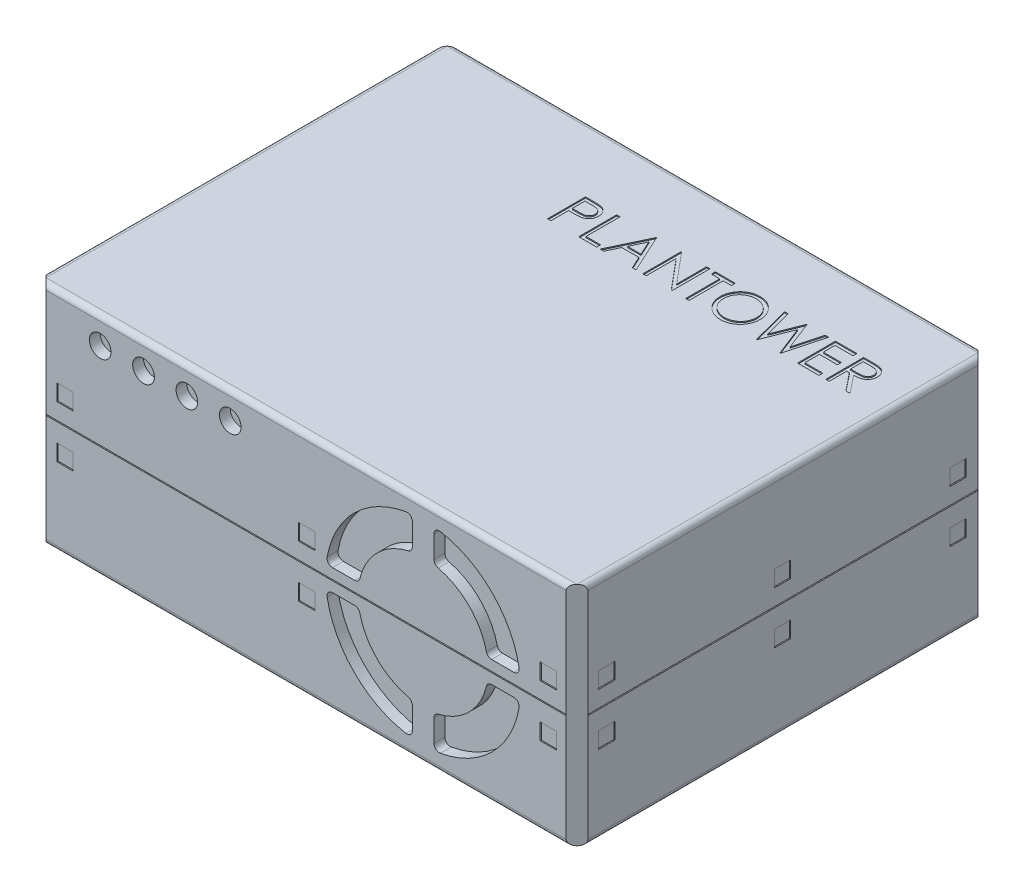
from build123d import *

# Parameters (mm, degrees)
SKETCH1_W                  = 50
SKETCH1_H                  = 38
BOSS_EXTRUDE1_DEPTH        = 20.9
FAN_HOLES_DEPTH            = 1
SKETCH3_W                  = 17
SKETCH3_H                  = 4.9
CABLE_SLOT_DEPTH           = 2
SKETCH4_R                  = 1
HOLES_DEPTH                = 1
CHAMFER1_SIZE              = 1
FILLET1_R                  = 0.5
FILLET3_R                  = 0.5
SKETCH5_W                  = 48
SKETCH5_H                  = 0.1
CUT_EXTRUDE1_DEPTH         = 0.1
SKETCH6_W                  = 36
SKETCH6_H                  = 0.1
CUT_EXTRUDE2_DEPTH         = 0.1
SKETCH7_W                  = 48
SKETCH7_H                  = 0.1
CUT_EXTRUDE3_DEPTH         = 0.1
SKETCH8_W                  = 36
SKETCH8_H                  = 0.1
CUT_EXTRUDE4_DEPTH         = 0.1
SKETCH9_W                  = 1.5
SKETCH9_H                  = 1.5
CUT_EXTRUDE5_DEPTH         = 0.1
LPATTERN1_COUNT            = 3
LPATTERN1_PITCH            = 16.2
LPATTERN2_COUNT            = 2
LPATTERN2_PITCH            = 4.8
LPATTERN2_COPY_1_SKETCH_W  = 1.5
LPATTERN2_COPY_1_SKETCH_H  = 1.5
LPATTERN2_COPY_1_DEPTH     = 0.1
LPATTERN2_COPY_2_SKETCH_W  = 1.5
LPATTERN2_COPY_2_SKETCH_H  = 1.5
LPATTERN2_COPY_2_DEPTH     = 0.1
SKETCH10_W                 = 1.5
SKETCH10_H                 = 1.5
CUT_EXTRUDE6_DEPTH         = 0.1
LPATTERN3_COUNT            = 3
LPATTERN3_PITCH            = 16.2
LPATTERN4_COUNT            = 2
LPATTERN4_PITCH            = 4.8
LPATTERN4_COPY_1_SKETCH_W  = 1.5
LPATTERN4_COPY_1_SKETCH_H  = 1.5
LPATTERN4_COPY_1_DEPTH     = 0.1
LPATTERN4_COPY_2_SKETCH_W  = 1.5
LPATTERN4_COPY_2_SKETCH_H  = 1.5
LPATTERN4_COPY_2_DEPTH     = 0.1
SKETCH11_W                 = 1.5
SKETCH11_H                 = 1.5
CUT_EXTRUDE7_DEPTH         = 0.1
LPATTERN5_COUNT            = 3
LPATTERN5_PITCH            = 22.3
LPATTERN6_COUNT            = 2
LPATTERN6_PITCH            = 4.8
LPATTERN6_COPY_1_SKETCH_W  = 1.5
LPATTERN6_COPY_1_SKETCH_H  = 1.5
LPATTERN6_COPY_1_DEPTH     = 0.1
LPATTERN6_COPY_2_SKETCH_W  = 1.5
LPATTERN6_COPY_2_SKETCH_H  = 1.5
LPATTERN6_COPY_2_DEPTH     = 0.1
SKETCH12_W                 = 1.5
SKETCH12_H                 = 1.5
CUT_EXTRUDE8_DEPTH         = 0.1
LPATTERN7_COUNT            = 3
LPATTERN7_PITCH            = 22.3
LPATTERN8_COUNT            = 2
LPATTERN8_PITCH            = 4.8
LPATTERN8_COPY_1_SKETCH_W  = 1.5
LPATTERN8_COPY_1_SKETCH_H  = 1.5
LPATTERN8_COPY_1_DEPTH     = 0.1
LPATTERN8_COPY_2_SKETCH_W  = 1.5
LPATTERN8_COPY_2_SKETCH_H  = 1.5
LPATTERN8_COPY_2_DEPTH     = 0.1
CUT_EXTRUDE9_START         = -0.1
CUT_EXTRUDE9_DEPTH         = 0.1
SKETCH14_R                 = 1
CUT_EXTRUDE10_DEPTH        = 20
LPATTERN9_COUNT            = 2
LPATTERN9_PITCH            = 46
LPATTERN10_COUNT           = 2
LPATTERN10_PITCH           = 33.7
LPATTERN10_COPY_1_SKETCH_R = 1
LPATTERN10_COPY_1_DEPTH    = 20


# Read off the part's stored shape, not the designer's step: Cut-Extrude9
with BuildPart() as part:
    # Sketch1 → Boss-Extrude1 (new body)
    with BuildSketch(Plane(origin=(0, 0, 0), x_dir=(1, 0, 0), z_dir=(0, 1, 0))):
        with Locations((25, 19)):
            Rectangle(SKETCH1_W, SKETCH1_H)
    extrude(amount=BOSS_EXTRUDE1_DEPTH)

    # Sketch2 → Fan holes (cut)
    with BuildSketch(Plane.XY):
        with BuildLine():
            Line((42.12455532, 11.45), (44.166600265, 11.45))
            ThreePointArc((44.166600265, 11.45), (44.55008276, 11.629155526), (44.658753222, 12.038235294))
            ThreePointArc((44.658753222, 12.038235294), (42.163961031, 16.813961031), (37.388235294, 19.308753222))
            ThreePointArc((37.388235294, 19.308753222), (36.979155526, 19.20008276), (36.8, 18.816600265))
            Line((36.8, 18.816600265), (36.8, 16.77455532))
            ThreePointArc((36.8, 16.77455532), (36.90776773, 16.464468484), (37.184615385, 16.288051065))
            ThreePointArc((37.184615385, 16.288051065), (40.042640687, 14.692640687), (41.638051065, 11.834615385))
            ThreePointArc((41.638051065, 11.834615385), (41.814468484, 11.55776773), (42.12455532, 11.45))
        make_face()
        with BuildLine():
            Line((34.8, 18.816600265), (34.8, 16.77455532))
            ThreePointArc((34.8, 16.77455532), (34.69223227, 16.464468484), (34.415384615, 16.288051065))
            ThreePointArc((34.415384615, 16.288051065), (31.557359313, 14.692640687), (29.961948935, 11.834615385))
            ThreePointArc((29.961948935, 11.834615385), (29.785531516, 11.55776773), (29.47544468, 11.45))
            Line((29.47544468, 11.45), (27.433399735, 11.45))
            ThreePointArc((27.433399735, 11.45), (27.04991724, 11.629155526), (26.941246778, 12.038235294))
            ThreePointArc((26.941246778, 12.038235294), (29.436038969, 16.813961031), (34.211764706, 19.308753222))
            ThreePointArc((34.211764706, 19.308753222), (34.620844474, 19.20008276), (34.8, 18.816600265))
        make_face()
        with BuildLine():
            Line((27.433399735, 9.45), (29.47544468, 9.45))
            ThreePointArc((29.47544468, 9.45), (29.785531516, 9.34223227), (29.961948935, 9.065384615))
            ThreePointArc((29.961948935, 9.065384615), (31.557359313, 6.207359313), (34.415384615, 4.611948935))
            ThreePointArc((34.415384615, 4.611948935), (34.69223227, 4.435531516), (34.8, 4.12544468))
            Line((34.8, 4.12544468), (34.8, 2.083399735))
            ThreePointArc((34.8, 2.083399735), (34.620844474, 1.69991724), (34.211764706, 1.591246778))
            ThreePointArc((34.211764706, 1.591246778), (29.436038969, 4.086038969), (26.941246778, 8.861764706))
            ThreePointArc((26.941246778, 8.861764706), (27.04991724, 9.270844474), (27.433399735, 9.45))
        make_face()
        with BuildLine():
            Line((42.12455532, 9.45), (44.166600265, 9.45))
            ThreePointArc((44.166600265, 9.45), (44.55008276, 9.270844474), (44.658753222, 8.861764706))
            ThreePointArc((44.658753222, 8.861764706), (42.163961031, 4.086038969), (37.388235294, 1.591246778))
            ThreePointArc((37.388235294, 1.591246778), (36.979155526, 1.69991724), (36.8, 2.083399735))
            Line((36.8, 2.083399735), (36.8, 4.12544468))
            ThreePointArc((36.8, 4.12544468), (36.90776773, 4.435531516), (37.184615385, 4.611948935))
            ThreePointArc((37.184615385, 4.611948935), (40.042640687, 6.207359313), (41.638051065, 9.065384615))
            ThreePointArc((41.638051065, 9.065384615), (41.814468484, 9.34223227), (42.12455532, 9.45))
        make_face()
    extrude(amount=-FAN_HOLES_DEPTH, mode=Mode.SUBTRACT)

    # Sketch3 → Cable slot (cut)
    with BuildSketch(Plane(origin=(0, 0, -38), x_dir=(-1, 0, 0), z_dir=(0, 0, -1))):
        with Locations((-36, 10.45)):
            Rectangle(SKETCH3_W, SKETCH3_H)
    extrude(amount=-CABLE_SLOT_DEPTH, mode=Mode.SUBTRACT)

    # Sketch4 → Holes (cut)
    with BuildSketch(Plane.XY):
        with Locations((6, 18.45)):
            Circle(SKETCH4_R)
        with Locations((10, 18.45)):
            Circle(SKETCH4_R)
        with Locations((14, 18.45)):
            Circle(SKETCH4_R)
        with Locations((18, 18.45)):
            Circle(SKETCH4_R)
    extrude(amount=-HOLES_DEPTH, mode=Mode.SUBTRACT)

    # Chamfer1
    chamfer1_edges = [part.edges().sort_by_distance(p)[0] for p in [
        (0, 10.45, -38),
        (50, 10.45, -38),
        (50, 10.45, 0),
        (0, 10.45, 0),
    ]]
    chamfer(chamfer1_edges, length=CHAMFER1_SIZE)

    # Fillet1
    fillet1_edges = [part.edges().sort_by_distance(p)[0] for p in [
        (0, 20.9, -19),
        (25, 20.9, -38),
        (25, 20.9, 0),
        (50, 20.9, -19),
    ]]
    fillet(fillet1_edges, radius=FILLET1_R - 0.0001)  # a hair under: the kernel refuses the full size

    # Fillet3
    fillet3_edges = [part.edges().sort_by_distance(p)[0] for p in [
        (25, 0, 0),
        (0, 0, -19),
        (50, 0, -19),
        (25, 0, -38),
    ]]
    fillet(fillet3_edges, radius=FILLET3_R - 0.0001)  # a hair under: the kernel refuses the full size

    # Sketch5 → Cut-Extrude1 (cut)
    with BuildSketch(Plane.XY):
        with Locations((25, 10.45)):
            Rectangle(SKETCH5_W, SKETCH5_H)
    extrude(amount=-CUT_EXTRUDE1_DEPTH, mode=Mode.SUBTRACT)

    # Sketch6 → Cut-Extrude2 (cut)
    with BuildSketch(Plane.ZY):
        with Locations((-19, 10.45)):
            Rectangle(SKETCH6_W, SKETCH6_H)
    extrude(amount=-CUT_EXTRUDE2_DEPTH, mode=Mode.SUBTRACT)

    # Sketch7 → Cut-Extrude3 (cut)
    with BuildSketch(Plane(origin=(0, 0, -38), x_dir=(-1, 0, 0), z_dir=(0, 0, -1))):
        with Locations((-25, 10.45)):
            Rectangle(SKETCH7_W, SKETCH7_H)
    extrude(amount=-CUT_EXTRUDE3_DEPTH, mode=Mode.SUBTRACT)

    # Sketch8 → Cut-Extrude4 (cut)
    with BuildSketch(Plane(origin=(50, 0, 0), x_dir=(0, 0, -1), z_dir=(1, 0, 0))):
        with Locations((19, 10.45)):
            Rectangle(SKETCH8_W, SKETCH8_H)
    extrude(amount=-CUT_EXTRUDE4_DEPTH, mode=Mode.SUBTRACT)

    # Sketch9 → Cut-Extrude5 (cut)
    with BuildSketch(Plane(origin=(50, 0, 0), x_dir=(0, 0, -1), z_dir=(1, 0, 0))):
        with Locations((2.75, 12.75)):
            Rectangle(SKETCH9_W, SKETCH9_H)
    cut_extrude5 = extrude(amount=-CUT_EXTRUDE5_DEPTH, mode=Mode.SUBTRACT)

    # LPattern1: Cut-Extrude5 ×3
    with Locations(*[(0, 0, -i * LPATTERN1_PITCH) for i in range(1, LPATTERN1_COUNT)]):
        add(cut_extrude5, mode=Mode.SUBTRACT)

    # LPattern2: Cut-Extrude5 ×2
    with Locations(*[(0, -i * LPATTERN2_PITCH, 0) for i in range(1, LPATTERN2_COUNT)]):
        add(cut_extrude5, mode=Mode.SUBTRACT)

    # LPattern2 copy 1 sketch → LPattern2 copy 1 (cut)
    with BuildSketch(Plane(origin=(50, -4.8, -16.2), x_dir=(0, 0, -1), z_dir=(1, 0, 0))):
        with Locations((2.75, 12.75)):
            Rectangle(LPATTERN2_COPY_1_SKETCH_W, LPATTERN2_COPY_1_SKETCH_H)
    extrude(amount=-LPATTERN2_COPY_1_DEPTH, mode=Mode.SUBTRACT)

    # LPattern2 copy 2 sketch → LPattern2 copy 2 (cut)
    with BuildSketch(Plane(origin=(50, -4.8, -32.4), x_dir=(0, 0, -1), z_dir=(1, 0, 0))):
        with Locations((2.75, 12.75)):
            Rectangle(LPATTERN2_COPY_2_SKETCH_W, LPATTERN2_COPY_2_SKETCH_H)
    extrude(amount=-LPATTERN2_COPY_2_DEPTH, mode=Mode.SUBTRACT)

    # Sketch10 → Cut-Extrude6 (cut)
    with BuildSketch(Plane.ZY):
        with Locations((-35.25, 12.75)):
            Rectangle(SKETCH10_W, SKETCH10_H)
    cut_extrude6 = extrude(amount=-CUT_EXTRUDE6_DEPTH, mode=Mode.SUBTRACT)

    # LPattern3: Cut-Extrude6 ×3
    with Locations(*[(0, 0, i * LPATTERN3_PITCH) for i in range(1, LPATTERN3_COUNT)]):
        add(cut_extrude6, mode=Mode.SUBTRACT)

    # LPattern4: Cut-Extrude6 ×2
    with Locations(*[(0, -i * LPATTERN4_PITCH, 0) for i in range(1, LPATTERN4_COUNT)]):
        add(cut_extrude6, mode=Mode.SUBTRACT)

    # LPattern4 copy 1 sketch → LPattern4 copy 1 (cut)
    with BuildSketch(Plane(origin=(0, -4.8, 16.2), x_dir=(0, 0, 1), z_dir=(-1, 0, 0))):
        with Locations((-35.25, 12.75)):
            Rectangle(LPATTERN4_COPY_1_SKETCH_W, LPATTERN4_COPY_1_SKETCH_H)
    extrude(amount=-LPATTERN4_COPY_1_DEPTH, mode=Mode.SUBTRACT)

    # LPattern4 copy 2 sketch → LPattern4 copy 2 (cut)
    with BuildSketch(Plane(origin=(0, -4.8, 32.4), x_dir=(0, 0, 1), z_dir=(-1, 0, 0))):
        with Locations((-35.25, 12.75)):
            Rectangle(LPATTERN4_COPY_2_SKETCH_W, LPATTERN4_COPY_2_SKETCH_H)
    extrude(amount=-LPATTERN4_COPY_2_DEPTH, mode=Mode.SUBTRACT)

    # Sketch11 → Cut-Extrude7 (cut)
    with BuildSketch(Plane.XY):
        with Locations((2.75, 12.75)):
            Rectangle(SKETCH11_W, SKETCH11_H)
    cut_extrude7 = extrude(amount=-CUT_EXTRUDE7_DEPTH, mode=Mode.SUBTRACT)

    # LPattern5: Cut-Extrude7 ×3
    with Locations(*[(i * LPATTERN5_PITCH, 0, 0) for i in range(1, LPATTERN5_COUNT)]):
        add(cut_extrude7, mode=Mode.SUBTRACT)

    # LPattern6: Cut-Extrude7 ×2
    with Locations(*[(0, -i * LPATTERN6_PITCH, 0) for i in range(1, LPATTERN6_COUNT)]):
        add(cut_extrude7, mode=Mode.SUBTRACT)

    # LPattern6 copy 1 sketch → LPattern6 copy 1 (cut)
    with BuildSketch(Plane(origin=(22.3, -4.8, 0), x_dir=(1, 0, 0), z_dir=(0, 0, 1))):
        with Locations((2.75, 12.75)):
            Rectangle(LPATTERN6_COPY_1_SKETCH_W, LPATTERN6_COPY_1_SKETCH_H)
    extrude(amount=-LPATTERN6_COPY_1_DEPTH, mode=Mode.SUBTRACT)

    # LPattern6 copy 2 sketch → LPattern6 copy 2 (cut)
    with BuildSketch(Plane(origin=(44.6, -4.8, 0), x_dir=(1, 0, 0), z_dir=(0, 0, 1))):
        with Locations((2.75, 12.75)):
            Rectangle(LPATTERN6_COPY_2_SKETCH_W, LPATTERN6_COPY_2_SKETCH_H)
    extrude(amount=-LPATTERN6_COPY_2_DEPTH, mode=Mode.SUBTRACT)

    # Sketch12 → Cut-Extrude8 (cut)
    with BuildSketch(Plane(origin=(0, 0, -38), x_dir=(-1, 0, 0), z_dir=(0, 0, -1))):
        with Locations((-47.25, 12.75)):
            Rectangle(SKETCH12_W, SKETCH12_H)
    cut_extrude8 = extrude(amount=-CUT_EXTRUDE8_DEPTH, mode=Mode.SUBTRACT)

    # LPattern7: Cut-Extrude8 ×3
    with Locations(*[(-i * LPATTERN7_PITCH, 0, 0) for i in range(1, LPATTERN7_COUNT)]):
        add(cut_extrude8, mode=Mode.SUBTRACT)

    # LPattern8: Cut-Extrude8 ×2
    with Locations(*[(0, -i * LPATTERN8_PITCH, 0) for i in range(1, LPATTERN8_COUNT)]):
        add(cut_extrude8, mode=Mode.SUBTRACT)

    # LPattern8 copy 1 sketch → LPattern8 copy 1 (cut)
    with BuildSketch(Plane(origin=(-22.3, -4.8, -38), x_dir=(-1, 0, 0), z_dir=(0, 0, -1))):
        with Locations((-47.25, 12.75)):
            Rectangle(LPATTERN8_COPY_1_SKETCH_W, LPATTERN8_COPY_1_SKETCH_H)
    extrude(amount=-LPATTERN8_COPY_1_DEPTH, mode=Mode.SUBTRACT)

    # LPattern8 copy 2 sketch → LPattern8 copy 2 (cut)
    with BuildSketch(Plane(origin=(-44.6, -4.8, -38), x_dir=(-1, 0, 0), z_dir=(0, 0, -1))):
        with Locations((-47.25, 12.75)):
            Rectangle(LPATTERN8_COPY_2_SKETCH_W, LPATTERN8_COPY_2_SKETCH_H)
    extrude(amount=-LPATTERN8_COPY_2_DEPTH, mode=Mode.SUBTRACT)

    # Cut-Extrude9 outline → Cut-Extrude9 (cut)
    # profile 1 of 9: a face of its own
    with BuildSketch(Plane(origin=(0, 20.9, 0), x_dir=(1, 0, 0), z_dir=(0, 1, 0)).offset(CUT_EXTRUDE9_START)):
        with BuildLine():
            add(Edge.make_bspline(
                [(45.298378457, 31.852568928), (45.345119585, 31.852413342), (45.43486773, 31.8521146), (45.563441, 31.850448837), (45.680268097, 31.845674481), (45.785287936, 31.841565898), (45.878498591, 31.834073956), (45.960185882, 31.826913309), (46.02997358, 31.817539648), (46.072219431, 31.808834225), (46.091347207, 31.804892646)],
                knots=[0, 0, 0, 0, 0.176257755, 0.338434414, 0.484822051, 0.617157578, 0.734698361, 0.837385184, 0.926372421, 1, 1, 1, 1], degree=3))
            Line((45.298378457, 31.852568928), (44.597957784, 31.852568928))
            Line((44.597957784, 31.852568928), (44.597957784, 28.352568928))
            Line((44.597957784, 28.352568928), (44.912060348, 28.352568928))
            Line((44.912060348, 28.352568928), (44.912060348, 29.967953543))
            Line((44.912060348, 29.967953543), (45.167268681, 29.967953543))
            Line((45.167268681, 29.967953543), (46.453126053, 28.352568928))
            Line((46.453126053, 28.352568928), (46.841547527, 28.352568928))
            Line((46.841547527, 28.352568928), (45.555690155, 29.967953543))
            add(Edge.make_bspline(
                [(46.796675732, 30.916571332), (46.795206734, 30.869936227), (46.792340338, 30.778939059), (46.765615235, 30.646878178), (46.721838715, 30.523688863), (46.661515426, 30.409526225), (46.58469595, 30.30661558), (46.492371159, 30.216225125), (46.384489548, 30.140585212), (46.284060232, 30.088132407), (46.195346032, 30.054539499), (46.122312719, 30.03090314), (46.042645742, 30.012641175), (45.957108407, 29.996281043), (45.865344752, 29.983929348), (45.767574712, 29.974882754), (45.663728561, 29.969228705), (45.592389491, 29.9683867), (45.555690155, 29.967953543)],
                knots=[0, 0, 0, 0, 0.078780236, 0.153720644, 0.22671353, 0.299191166, 0.371189997, 0.443006414, 0.516689173, 0.593217217, 0.633872918, 0.676989142, 0.722899506, 0.771958611, 0.824211323, 0.879378651, 0.937948119, 1, 1, 1, 1], degree=3))
            add(Edge.make_bspline(
                [(46.091347207, 31.804892646), (46.116953831, 31.798565881), (46.16762082, 31.786047317), (46.240570886, 31.759587716), (46.31008521, 31.728968091), (46.375875035, 31.693004371), (46.437610826, 31.651429591), (46.495929137, 31.604961469), (46.5510946, 31.553854263), (46.60087623, 31.496819422), (46.647815282, 31.436982912), (46.687403908, 31.372279155), (46.721530388, 31.304617628), (46.748700905, 31.23331021), (46.770578879, 31.159048438), (46.786005118, 31.081159641), (46.795256306, 30.999998666), (46.796198161, 30.944640757), (46.796675732, 30.916571332)],
                knots=[0, 0, 0, 0, 0.064216843, 0.127063766, 0.188744538, 0.249132103, 0.309452533, 0.369826676, 0.430650142, 0.492351932, 0.554072106, 0.615689784, 0.676797703, 0.738439048, 0.80131691, 0.865184512, 0.931641324, 1, 1, 1, 1], degree=3))
        make_face()
        with BuildLine():
            add(Edge.make_bspline(
                [(46.482573168, 30.917272454), (46.481371047, 30.945419027), (46.478988882, 31.001195266), (46.459540113, 31.082851176), (46.426650732, 31.159918126), (46.382328494, 31.232082611), (46.328329339, 31.297588347), (46.265011526, 31.3536355), (46.194106331, 31.399884965), (46.127835133, 31.429439346), (46.06860092, 31.447559199), (46.01717126, 31.460310363), (45.959059783, 31.470554832), (45.893984324, 31.478762892), (45.822222693, 31.485817837), (45.743412042, 31.490569615), (45.658075262, 31.493383479), (45.598928331, 31.493522568), (45.568310348, 31.493594569)],
                knots=[0, 0, 0, 0, 0.068814296, 0.136364825, 0.204019354, 0.273063739, 0.34291332, 0.410965444, 0.479168767, 0.549308007, 0.587651576, 0.630646669, 0.678878786, 0.731934299, 0.791111423, 0.85528319, 0.925085939, 1, 1, 1, 1], degree=3))
            add(Edge.make_bspline(
                [(45.552885668, 30.32202005), (45.582805707, 30.322006813), (45.640799264, 30.321981157), (45.724699929, 30.325974933), (45.802820041, 30.330518251), (45.874860793, 30.337467597), (45.940854368, 30.346423668), (46.000767782, 30.357626653), (46.054698833, 30.370678715), (46.117597372, 30.390880341), (46.187833903, 30.422886359), (46.264165363, 30.469451858), (46.329167701, 30.528020977), (46.384085563, 30.594994433), (46.428214995, 30.668630682), (46.459327049, 30.748047051), (46.479069491, 30.831238649), (46.481398037, 30.888416757), (46.482573168, 30.917272454)],
                knots=[0, 0, 0, 0, 0.07166815, 0.138913286, 0.20118457, 0.259124428, 0.312255041, 0.36068151, 0.405086143, 0.445101659, 0.51877778, 0.589461579, 0.658462242, 0.727283218, 0.796322487, 0.863174893, 0.930949381, 1, 1, 1, 1], degree=3))
            Line((45.552885668, 30.32202005), (44.912060348, 30.326927902))
            Line((44.912060348, 30.326927902), (44.912060348, 31.493594569))
            Line((44.912060348, 31.493594569), (45.568310348, 31.493594569))
        make_face(mode=Mode.SUBTRACT)
    # profile 2 of 9: a face of its own
    with BuildSketch(Plane(origin=(0, 20.9, 0), x_dir=(1, 0, 0), z_dir=(0, 1, 0)).offset(CUT_EXTRUDE9_START)):
        with BuildLine():
            add(Edge.make_bspline(
                [(33.110778296, 30.087144248), (33.111312932, 30.128776918), (33.112375458, 30.211517041), (33.125167151, 30.334383641), (33.143728852, 30.455274299), (33.170330765, 30.573845247), (33.205122432, 30.689806232), (33.246174459, 30.803956995), (33.296314304, 30.915140718), (33.352994952, 31.02388411), (33.41625676, 31.128492016), (33.48613251, 31.227371599), (33.560167878, 31.321352596), (33.641331272, 31.4079996), (33.726947717, 31.489833256), (33.818406095, 31.565595973), (33.91514834, 31.635970924), (34.017590719, 31.699391265), (34.123208994, 31.7567504), (34.232085772, 31.805972251), (34.342742344, 31.848218312), (34.455696991, 31.882459137), (34.570649764, 31.909491173), (34.687851548, 31.927898527), (34.807208974, 31.940722845), (34.887620293, 31.941780347), (34.928085989, 31.942312518)],
                knots=[0, 0, 0, 0, 0.043208986, 0.085872872, 0.128120007, 0.170151964, 0.211917621, 0.253753003, 0.296006409, 0.338443357, 0.381015368, 0.422820479, 0.464089056, 0.505125849, 0.545974971, 0.586985211, 0.628338592, 0.670083802, 0.711991602, 0.753039155, 0.794049395, 0.834885543, 0.875498313, 0.9165473, 0.958003779, 1, 1, 1, 1], degree=3))
            add(Edge.make_bspline(
                [(34.956130861, 28.262825338), (34.892706542, 28.264374725), (34.767680326, 28.267428979), (34.58414329, 28.293610384), (34.407865546, 28.334551688), (34.239351195, 28.393061124), (34.078506266, 28.468678355), (33.925016183, 28.560882734), (33.779497036, 28.670289875), (33.643155289, 28.794456449), (33.518406091, 28.929628001), (33.409646715, 29.074462256), (33.317421602, 29.226117713), (33.24205827, 29.385015237), (33.18239381, 29.55038668), (33.141688992, 29.723335157), (33.11535304, 29.902874663), (33.112318193, 30.025117562), (33.110778296, 30.087144248)],
                knots=[0, 0, 0, 0, 0.065818877, 0.129746527, 0.192071954, 0.253459424, 0.314569588, 0.376279881, 0.439025654, 0.503267029, 0.567492823, 0.629704796, 0.690999649, 0.751451651, 0.812004364, 0.873149681, 0.935635484, 1, 1, 1, 1], degree=3))
            add(Edge.make_bspline(
                [(36.790265476, 30.103971172), (36.788715543, 30.041013725), (36.785660447, 29.916917305), (36.759491669, 29.734773861), (36.718450669, 29.559683164), (36.659854403, 29.391937511), (36.584628925, 29.231359948), (36.491973754, 29.078372994), (36.382832543, 28.932926495), (36.258625692, 28.79661383), (36.12322465, 28.671616359), (35.977994383, 28.562697484), (35.826201063, 28.468973359), (35.665891355, 28.394189685), (35.499191318, 28.334417765), (35.324608995, 28.293665135), (35.142962441, 28.267378091), (35.019091437, 28.264359575), (34.956130861, 28.262825338)],
                knots=[0, 0, 0, 0, 0.065226504, 0.128568996, 0.190320378, 0.251377989, 0.312387528, 0.373788704, 0.43643116, 0.500566755, 0.564686795, 0.627135518, 0.688455409, 0.749245746, 0.810155177, 0.871670926, 0.934773496, 1, 1, 1, 1], degree=3))
            add(Edge.make_bspline(
                [(34.928085989, 31.942312518), (34.992894095, 31.940671038), (35.120182562, 31.937447037), (35.307257459, 31.912767934), (35.485852555, 31.870072544), (35.657422693, 31.813209561), (35.81991567, 31.737355176), (35.974554563, 31.645670028), (36.120971436, 31.537193569), (36.257192818, 31.412764342), (36.381849768, 31.277380888), (36.491675654, 31.132902978), (36.583717948, 30.980204176), (36.659303735, 30.819743345), (36.718602345, 30.651883377), (36.759521389, 30.475729374), (36.785659539, 30.292422684), (36.788715316, 30.16739582), (36.790265476, 30.103971172)],
                knots=[0, 0, 0, 0, 0.066570035, 0.130749041, 0.1934128, 0.254989399, 0.316113556, 0.377261758, 0.439400784, 0.502970589, 0.566524976, 0.628231103, 0.689090611, 0.749344669, 0.810169593, 0.871609824, 0.934869184, 1, 1, 1, 1], degree=3))
        make_face()
        with BuildLine():
            add(Edge.make_bspline(
                [(36.476162912, 30.104672293), (36.475761799, 30.138587798), (36.474966117, 30.205865448), (36.464423643, 30.305326266), (36.449322752, 30.402579478), (36.427560044, 30.497243281), (36.399509891, 30.589341806), (36.36492256, 30.678788553), (36.324137261, 30.765916748), (36.277329036, 30.850511045), (36.224713213, 30.931685783), (36.16721897, 31.009288196), (36.103853621, 31.081860937), (36.036427597, 31.151195631), (35.963256711, 31.215813521), (35.884672417, 31.275736042), (35.801628739, 31.332409316), (35.713701504, 31.383534878), (35.62295755, 31.43074911), (35.529843592, 31.471200114), (35.435414493, 31.505572233), (35.33991038, 31.534889198), (35.242527402, 31.556297228), (35.143923573, 31.571525278), (35.044235315, 31.582123664), (34.977192095, 31.582932042), (34.943510668, 31.583338159)],
                knots=[0, 0, 0, 0, 0.042915082, 0.085129971, 0.126473319, 0.167453038, 0.207976333, 0.248249378, 0.288749987, 0.329669857, 0.370537287, 0.411128564, 0.451818913, 0.492405877, 0.533485862, 0.575263062, 0.617440613, 0.660671688, 0.703940204, 0.746867522, 0.7890793, 0.831104042, 0.87323799, 0.91516577, 0.957380658, 1, 1, 1, 1], degree=3))
            add(Edge.make_bspline(
                [(34.943510668, 28.621799697), (34.97812017, 28.622275202), (35.046761206, 28.62321827), (35.148856729, 28.632716946), (35.24911294, 28.647948816), (35.34738922, 28.669879471), (35.443574032, 28.697326678), (35.538068835, 28.729934406), (35.629867125, 28.770615609), (35.720126963, 28.815563561), (35.806523205, 28.866803719), (35.888998737, 28.921841868), (35.965474717, 28.982810489), (36.037863788, 29.047128301), (36.105491477, 29.116092149), (36.167900461, 29.189612371), (36.224880593, 29.268153028), (36.27734624, 29.350438434), (36.324149503, 29.436434687), (36.364928602, 29.524964365), (36.399524718, 29.615809474), (36.427453223, 29.709101046), (36.449338684, 29.804661894), (36.464418604, 29.902619973), (36.474967043, 30.002779315), (36.47576212, 30.070523171), (36.476162912, 30.104672293)],
                knots=[0, 0, 0, 0, 0.043633218, 0.086537777, 0.129177336, 0.171436324, 0.213415895, 0.255265955, 0.297369481, 0.339940748, 0.382347459, 0.423952947, 0.464871163, 0.505572294, 0.546002577, 0.586567975, 0.627064799, 0.668270684, 0.709549225, 0.750428154, 0.791096194, 0.832027145, 0.873135955, 0.914610764, 0.956955986, 1, 1, 1, 1], degree=3))
            add(Edge.make_bspline(
                [(33.424880861, 30.088546492), (33.426155723, 30.037984271), (33.42866377, 29.938512741), (33.450621341, 29.792744597), (33.484443315, 29.652656311), (33.534300681, 29.519014401), (33.596651296, 29.390670119), (33.673678186, 29.268762014), (33.764937272, 29.15325714), (33.868600799, 29.044961871), (33.981923505, 28.946116066), (34.102256235, 28.859352658), (34.228309843, 28.785942408), (34.360413045, 28.726137336), (34.497860584, 28.678747598), (34.641538135, 28.646268967), (34.790488595, 28.624893511), (34.89201925, 28.622840755), (34.943510668, 28.621799697)],
                knots=[0, 0, 0, 0, 0.064503999, 0.126899322, 0.18774654, 0.248149733, 0.308586065, 0.369583005, 0.431826965, 0.496179723, 0.560667855, 0.623504455, 0.685260411, 0.746536822, 0.808327352, 0.870486188, 0.934316883, 1, 1, 1, 1], degree=3))
            add(Edge.make_bspline(
                [(34.943510668, 31.583338159), (34.910296035, 31.582933268), (34.844184302, 31.582127359), (34.745899766, 31.571511643), (34.648907832, 31.556381754), (34.55318847, 31.534800233), (34.45914218, 31.505396181), (34.365892339, 31.471555272), (34.274289285, 31.430334182), (34.184635427, 31.383761478), (34.097720352, 31.332212557), (34.015707651, 31.27524079), (33.938385007, 31.214182235), (33.86594174, 31.148894398), (33.798590568, 31.079044796), (33.735005866, 31.00569236), (33.677736285, 30.926740469), (33.625250708, 30.844330062), (33.578282868, 30.758568481), (33.536517513, 30.670358619), (33.502353504, 30.578980932), (33.474491128, 30.485426774), (33.451391317, 30.389844315), (33.436757393, 30.291508466), (33.426025033, 30.190913354), (33.425265188, 30.1229315), (33.424880861, 30.088546492)],
                knots=[0, 0, 0, 0, 0.042023329, 0.083644911, 0.124983795, 0.166247461, 0.207701556, 0.249631071, 0.29174177, 0.334742875, 0.377460169, 0.419556319, 0.461044176, 0.502096284, 0.542890714, 0.583800819, 0.624863583, 0.666224689, 0.707399186, 0.748556678, 0.789654591, 0.830739726, 0.872070142, 0.913993395, 0.95649813, 1, 1, 1, 1], degree=3))
        make_face(mode=Mode.SUBTRACT)
    # profile 3 of 9: a face of its own
    with BuildSketch(Plane(origin=(0, 20.9, 0), x_dir=(1, 0, 0), z_dir=(0, 1, 0)).offset(CUT_EXTRUDE9_START)):
        with BuildLine():
            add(Edge.make_bspline(
                [(19.617689354, 31.852568928), (19.66490026, 31.852517032), (19.755358453, 31.852417596), (19.885073509, 31.84940285), (20.00288324, 31.845376158), (20.108533621, 31.839794265), (20.202349719, 31.833197675), (20.283907019, 31.823945635), (20.353846575, 31.81428534), (20.395753025, 31.804463933), (20.414864835, 31.799984793)],
                knots=[0, 0, 0, 0, 0.176955752, 0.33905508, 0.486318225, 0.618780923, 0.735618828, 0.838742477, 0.926457068, 1, 1, 1, 1], degree=3))
            Line((19.617689354, 31.852568928), (18.931291117, 31.852568928))
            Line((18.931291117, 31.852568928), (18.931291117, 28.352568928))
            Line((18.931291117, 28.352568928), (19.245393681, 28.352568928))
            Line((19.245393681, 28.352568928), (19.245393681, 29.967953543))
            Line((19.245393681, 29.967953543), (19.495694162, 29.967953543))
            add(Edge.make_bspline(
                [(20.386819963, 30.025445531), (20.364892629, 30.020782549), (20.316837602, 30.010563355), (20.23769488, 29.999154898), (20.145549494, 29.989417298), (20.040527214, 29.98211616), (19.922722309, 29.975865792), (19.792071052, 29.970897698), (19.648316974, 29.968167844), (19.54804573, 29.968027051), (19.495694162, 29.967953543)],
                knots=[0, 0, 0, 0, 0.075173117, 0.164746258, 0.268016881, 0.385911876, 0.517789479, 0.663690977, 0.824413221, 1, 1, 1, 1], degree=3))
            add(Edge.make_bspline(
                [(21.085137271, 30.913766845), (21.084715846, 30.884989068), (21.0838913, 30.828683404), (21.073995015, 30.746310616), (21.060664823, 30.667592226), (21.040167771, 30.592702775), (21.013322098, 30.522087005), (20.981830045, 30.454665773), (20.943846515, 30.391586101), (20.900201685, 30.332618983), (20.85165009, 30.277709071), (20.798397152, 30.227254276), (20.74065786, 30.181549938), (20.678615712, 30.140493594), (20.611665863, 30.105037315), (20.540823709, 30.07328001), (20.465473493, 30.046608949), (20.413330979, 30.032578888), (20.386819963, 30.025445531)],
                knots=[0, 0, 0, 0, 0.070118894, 0.137192353, 0.202016181, 0.264631407, 0.326116547, 0.386010305, 0.445811847, 0.505297697, 0.564633278, 0.624282625, 0.683902032, 0.743952771, 0.805387731, 0.868388031, 0.933084028, 1, 1, 1, 1], degree=3))
            add(Edge.make_bspline(
                [(20.414864835, 31.799984793), (20.439058369, 31.793362844), (20.486875346, 31.780274982), (20.555776389, 31.754061258), (20.621330235, 31.722979093), (20.683761793, 31.687555153), (20.742303876, 31.646269589), (20.797829917, 31.600795971), (20.849849897, 31.550084403), (20.898071289, 31.494703663), (20.942356087, 31.435583453), (20.98048577, 31.371841223), (21.012412997, 31.30454992), (21.039796268, 31.233756349), (21.059504722, 31.158866025), (21.074351622, 31.080399313), (21.08377525, 30.998364623), (21.084677812, 30.942304755), (21.085137271, 30.913766845)],
                knots=[0, 0, 0, 0, 0.062481339, 0.123490383, 0.183411094, 0.243153221, 0.302126735, 0.361709671, 0.421842292, 0.482931901, 0.544552254, 0.60568072, 0.667679738, 0.729984388, 0.794550921, 0.86034562, 0.928907356, 1, 1, 1, 1], degree=3))
        make_face()
        with BuildLine():
            add(Edge.make_bspline(
                [(20.771034707, 30.912364601), (20.76977206, 30.940503114), (20.767262075, 30.996438997), (20.748606212, 31.078417757), (20.717256898, 31.156653462), (20.673800304, 31.229626547), (20.621059174, 31.295815351), (20.559759831, 31.353312478), (20.490046569, 31.399534181), (20.425198338, 31.429367462), (20.367597152, 31.447582738), (20.317565192, 31.460327578), (20.261074518, 31.470503185), (20.198106738, 31.478742687), (20.129149905, 31.485796149), (20.05361159, 31.490582126), (19.971777946, 31.493383582), (19.914967376, 31.493522537), (19.88551788, 31.493594569)],
                knots=[0, 0, 0, 0, 0.070043755, 0.139238317, 0.208197455, 0.279173374, 0.349986812, 0.418353846, 0.487609584, 0.557411073, 0.595330157, 0.637964052, 0.685912778, 0.738185165, 0.796102647, 0.858516544, 0.926657726, 1, 1, 1, 1], degree=3))
            add(Edge.make_bspline(
                [(19.85817413, 30.319215563), (19.888094056, 30.319200099), (19.945853856, 30.319170247), (20.029290079, 30.32315547), (20.106699366, 30.327756003), (20.177843941, 30.334491926), (20.242755876, 30.344013184), (20.301543405, 30.353624922), (20.353750688, 30.367530284), (20.414849889, 30.386253354), (20.482933237, 30.418185969), (20.557000785, 30.464535859), (20.619771372, 30.523616567), (20.674089669, 30.590044399), (20.717195547, 30.663943528), (20.748751539, 30.743012465), (20.767292696, 30.826440314), (20.76977889, 30.883528453), (20.771034707, 30.912364601)],
                knots=[0, 0, 0, 0, 0.072538371, 0.140033831, 0.202495681, 0.260575056, 0.313228338, 0.361583194, 0.404878361, 0.444127437, 0.516399693, 0.586506671, 0.655085374, 0.724383783, 0.793973529, 0.861637682, 0.930110942, 1, 1, 1, 1], degree=3))
            Line((19.85817413, 30.319215563), (19.245393681, 30.326927902))
            Line((19.245393681, 30.326927902), (19.245393681, 31.493594569))
            Line((19.245393681, 31.493594569), (19.88551788, 31.493594569))
        make_face(mode=Mode.SUBTRACT)
    # profile 4 of 9: a face of its own
    with BuildSketch(Plane(origin=(0, 20.9, 0), x_dir=(1, 0, 0), z_dir=(0, 1, 0)).offset(CUT_EXTRUDE9_START)):
        Polygon((43.969752655, 31.852568928), (41.995393681, 31.852568928), (41.995393681, 28.352568928), (43.969752655, 28.352568928), (43.969752655, 28.711543287), (42.309496245, 28.711543287), (42.309496245, 30.057697133), (43.969752655, 30.057697133), (43.969752655, 30.416671492), (42.309496245, 30.416671492), (42.309496245, 31.493594569), (43.969752655, 31.493594569), align=None)
    # profile 5 of 9: a face of its own
    with BuildSketch(Plane(origin=(0, 20.9, 0), x_dir=(1, 0, 0), z_dir=(0, 1, 0)).offset(CUT_EXTRUDE9_START)):
        Polygon((37.608474611, 31.852568928), (37.28385522, 31.852568928), (38.214944963, 28.352568928), (38.259816758, 28.352568928), (39.325521886, 31.029451941), (40.378606822, 28.352568928), (40.423478617, 28.352568928), (41.367188553, 31.852568928), (41.046074771, 31.852568928), (40.357573168, 29.303290082), (39.357773489, 31.852568928), (39.312200572, 31.852568928), (38.293470604, 29.285762037), align=None)
    # profile 6 of 9: a face of its own
    with BuildSketch(Plane(origin=(0, 20.9, 0), x_dir=(1, 0, 0), z_dir=(0, 1, 0)).offset(CUT_EXTRUDE9_START)):
        Polygon((32.751803938, 31.852568928), (30.912060348, 31.852568928), (30.912060348, 31.493594569), (31.674880861, 31.493594569), (31.674880861, 28.352568928), (31.988983425, 28.352568928), (31.988983425, 31.493594569), (32.751803938, 31.493594569), align=None)
    # profile 7 of 9: a face of its own
    with BuildSketch(Plane(origin=(0, 20.9, 0), x_dir=(1, 0, 0), z_dir=(0, 1, 0)).offset(CUT_EXTRUDE9_START)):
        Polygon((27.792068361, 31.852568928), (27.726162912, 31.852568928), (27.726162912, 28.352568928), (28.040265476, 28.352568928), (28.040265476, 31.100966364), (30.346956181, 28.352568928), (30.418470604, 28.352568928), (30.418470604, 31.852568928), (30.10436804, 31.852568928), (30.10436804, 29.097861396), align=None)
    # profile 8 of 9: a face of its own
    with BuildSketch(Plane(origin=(0, 20.9, 0), x_dir=(1, 0, 0), z_dir=(0, 1, 0)).offset(CUT_EXTRUDE9_START)):
        Polygon((25.482573168, 31.852568928), (25.437701373, 31.852568928), (23.777444963, 28.352568928), (24.120293521, 28.352568928), (24.652444963, 29.4743638), (26.239083585, 29.4743638), (26.75651147, 28.352568928), (27.097957784, 28.352568928), align=None)
        Polygon((25.456631662, 31.170377422), (26.073618841, 29.833338159), (24.822817559, 29.833338159), align=None, mode=Mode.SUBTRACT)
    # profile 9 of 9: a face of its own
    with BuildSketch(Plane(origin=(0, 20.9, 0), x_dir=(1, 0, 0), z_dir=(0, 1, 0)).offset(CUT_EXTRUDE9_START)):
        Polygon((22.117188553, 31.852568928), (21.803085989, 31.852568928), (21.803085989, 28.352568928), (23.463342399, 28.352568928), (23.463342399, 28.711543287), (22.117188553, 28.711543287), align=None)
    extrude(amount=CUT_EXTRUDE9_DEPTH, mode=Mode.SUBTRACT)

    # Sketch14 → Cut-Extrude10 (cut)
    with BuildSketch(Plane.XZ):
        with Locations(Location((48, -2, 0), (0, 0, 270))):
            Circle(SKETCH14_R)
    cut_extrude10 = extrude(amount=-CUT_EXTRUDE10_DEPTH, mode=Mode.SUBTRACT)

    # LPattern9: Cut-Extrude10 ×2
    with Locations(*[(-i * LPATTERN9_PITCH, 0, 0) for i in range(1, LPATTERN9_COUNT)]):
        add(cut_extrude10, mode=Mode.SUBTRACT)

    # LPattern10: Cut-Extrude10 ×2
    with Locations(*[(0, 0, -i * LPATTERN10_PITCH) for i in range(1, LPATTERN10_COUNT)]):
        add(cut_extrude10, mode=Mode.SUBTRACT)

    # LPattern10 copy 1 sketch → LPattern10 copy 1 (cut)
    with BuildSketch(Plane(origin=(-46, 0, -33.7), x_dir=(1, 0, 0), z_dir=(0, -1, 0))):
        with Locations(Location((48, -2, 0), (0, 0, 270))):
            Circle(LPATTERN10_COPY_1_SKETCH_R)
    extrude(amount=-LPATTERN10_COPY_1_DEPTH, mode=Mode.SUBTRACT)


solid = part.part
